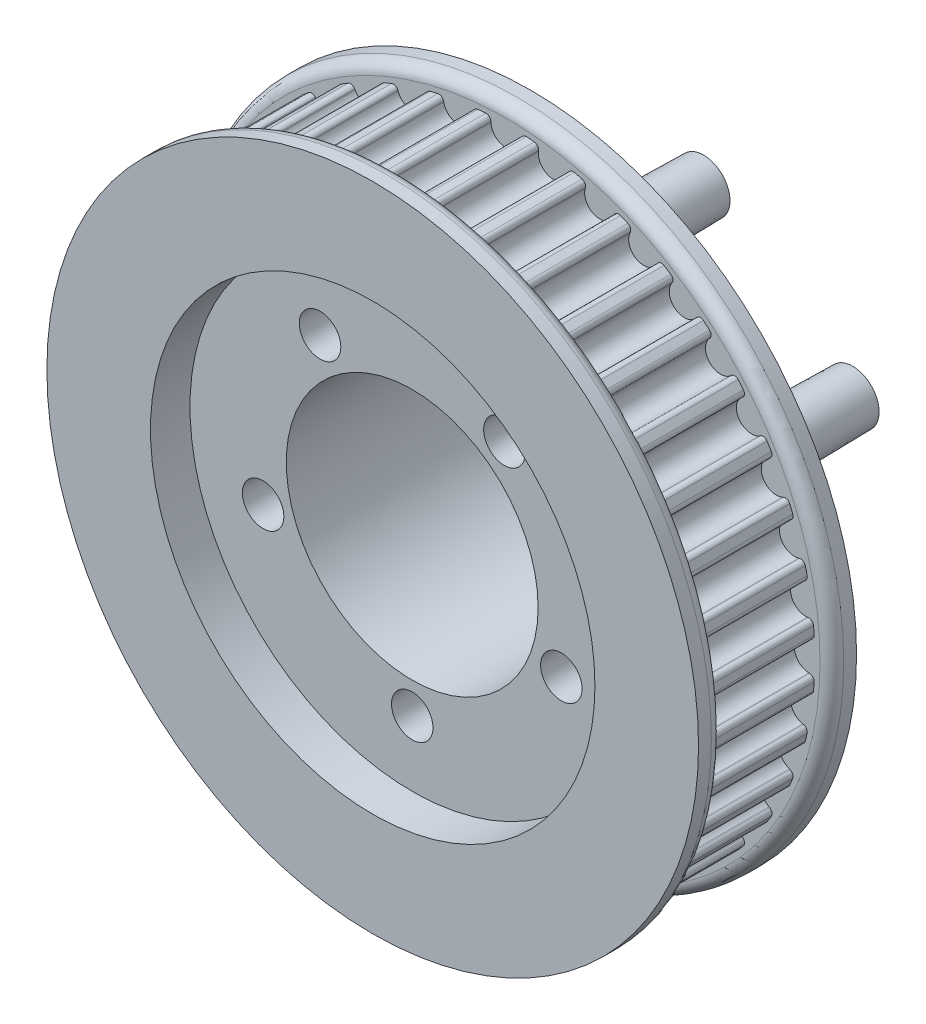
from build123d import *

# Parameters (mm, degrees)
SKETCH_3_R                       = 31.259488618
EXTRUDE_2_DEPTH                  = 11
CUT_EXTRUDE_2_DEPTH              = 46.555584261
FILLET_1_R                       = 0.48
PATTERN_CIRCULAR_1_COUNT         = 40
FILLET_1_OF_PATTERN_CIRCULAR_1_R = 0.48
SKETCH_8_R                       = 32.989488618
EXTRUDE_3_DEPTH                  = 2.5
EXTRUDE_START                    = 2.5
SKETCH_9_R                       = 32.989488618
EXTRUDE_4_DEPTH                  = 2.5
SKETCH_10_R                      = 2.675
EXTRUDE_5_DEPTH                  = 20
M5X0_8_2_D                       = 4.2
SKETCH_4_R                       = 12.75
CUT_EXTRUDE_3_DEPTH              = 55.155911257
FILLET_2_R                       = 1.2
SKETCH_16_R                      = 22.5
CUT_EXTRUDE_4_DEPTH              = 4


with BuildPart() as part:
    # 스케치3 → 보스-돌출2 (new body)
    with BuildSketch(Plane.XY):
        Circle(SKETCH_3_R)
    extrude(amount=EXTRUDE_2_DEPTH)

    # 스케치3<3> → 컷-돌출2 (cut, symmetric)
    with BuildSketch(Plane.XY):
        with BuildLine():
            Line((-1.561728679, 31.220452146), (-1.533083111, 30.647799791))
            ThreePointArc((-1.533083111, 30.647799791), (0, 29.189488618), (1.533083111, 30.647799791))
            Line((1.533083111, 30.647799791), (1.561728679, 31.220452146))
            ThreePointArc((1.561728679, 31.220452146), (0, 31.259488618), (-1.561728679, 31.220452146))
        make_face()
    cut_extrude_2 = extrude(amount=CUT_EXTRUDE_2_DEPTH, both=True, mode=Mode.SUBTRACT)

    # 필렛1
    fillet_1_edges = [part.edges().sort_by_distance(p)[0] for p in [
        (-1.561728679, 31.220452146, 5.5),
        (1.561728679, 31.220452146, 5.5),
    ]]
    fillet(fillet_1_edges, radius=FILLET_1_R)

    # 원형 패턴1: 컷-돌출2 ×40 about axis
    pattern_circular_1_axis = Axis((0, 0, 0), (0, 0, 1))
    for i in range(1, PATTERN_CIRCULAR_1_COUNT):
        add(cut_extrude_2.rotate(pattern_circular_1_axis, i * 360 / PATTERN_CIRCULAR_1_COUNT), mode=Mode.SUBTRACT)

    # 필렛1 of 원형 패턴1
    fillet_1_of_pattern_circular_1_edges = [part.edges().sort_by_distance(p)[0] for p in [
        (-6.426455937, 30.591768382, 5.5),
        (-3.341453522, 31.080384763, 5.5),
        (-11.132942522, 29.209813753, 5.5),
        (-8.162358048, 30.175015158, 5.5),
        (-15.565299114, 27.108616567, 5.5),
        (-12.78227823, 28.526636534, 5.5),
        (-19.614386384, 24.339915273, 5.5),
        (-17.087456299, 26.175837444, 5.5),
        (-23.180502364, 20.971884485, 5.5),
        (-20.971884485, 23.180502364, 5.5),
        (-26.175837444, 17.087456299, 5.5),
        (-24.339915273, 19.614386384, 5.5),
        (-28.526636534, 12.78227823, 5.5),
        (-27.108616567, 15.565299114, 5.5),
        (-30.175015158, 8.162358048, 5.5),
        (-29.209813753, 11.132942522, 5.5),
        (-31.080384763, 3.341453522, 5.5),
        (-30.591768382, 6.426455937, 5.5),
        (-31.220452146, -1.561728679, 5.5),
        (-31.220452146, 1.561728679, 5.5),
        (-30.591768382, -6.426455937, 5.5),
        (-31.080384763, -3.341453522, 5.5),
        (-29.209813753, -11.132942522, 5.5),
        (-30.175015158, -8.162358048, 5.5),
        (-27.108616567, -15.565299114, 5.5),
        (-28.526636534, -12.78227823, 5.5),
        (-24.339915273, -19.614386384, 5.5),
        (-26.175837444, -17.087456299, 5.5),
        (-20.971884485, -23.180502364, 5.5),
        (-23.180502364, -20.971884485, 5.5),
        (-17.087456299, -26.175837444, 5.5),
        (-19.614386384, -24.339915273, 5.5),
        (-12.78227823, -28.526636534, 5.5),
        (-15.565299114, -27.108616567, 5.5),
        (-8.162358048, -30.175015158, 5.5),
        (-11.132942522, -29.209813753, 5.5),
        (-3.341453522, -31.080384763, 5.5),
        (-6.426455937, -30.591768382, 5.5),
        (1.561728679, -31.220452146, 5.5),
        (-1.561728679, -31.220452146, 5.5),
        (6.426455937, -30.591768382, 5.5),
        (3.341453522, -31.080384763, 5.5),
        (11.132942522, -29.209813753, 5.5),
        (8.162358048, -30.175015158, 5.5),
        (15.565299114, -27.108616567, 5.5),
        (12.78227823, -28.526636534, 5.5),
        (19.614386384, -24.339915273, 5.5),
        (17.087456299, -26.175837444, 5.5),
        (23.180502364, -20.971884485, 5.5),
        (20.971884485, -23.180502364, 5.5),
        (26.175837444, -17.087456299, 5.5),
        (24.339915273, -19.614386384, 5.5),
        (28.526636534, -12.78227823, 5.5),
        (27.108616567, -15.565299114, 5.5),
        (30.175015158, -8.162358048, 5.5),
        (29.209813753, -11.132942522, 5.5),
        (31.080384763, -3.341453522, 5.5),
        (30.591768382, -6.426455937, 5.5),
        (31.220452146, 1.561728679, 5.5),
        (31.220452146, -1.561728679, 5.5),
        (30.591768382, 6.426455937, 5.5),
        (31.080384763, 3.341453522, 5.5),
        (29.209813753, 11.132942522, 5.5),
        (30.175015158, 8.162358048, 5.5),
        (27.108616567, 15.565299114, 5.5),
        (28.526636534, 12.78227823, 5.5),
        (24.339915273, 19.614386384, 5.5),
        (26.175837444, 17.087456299, 5.5),
        (20.971884485, 23.180502364, 5.5),
        (23.180502364, 20.971884485, 5.5),
        (17.087456299, 26.175837444, 5.5),
        (19.614386384, 24.339915273, 5.5),
        (12.78227823, 28.526636534, 5.5),
        (15.565299114, 27.108616567, 5.5),
        (8.162358048, 30.175015158, 5.5),
        (11.132942522, 29.209813753, 5.5),
        (3.341453522, 31.080384763, 5.5),
        (6.426455937, 30.591768382, 5.5),
    ]]
    fillet(fillet_1_of_pattern_circular_1_edges, radius=FILLET_1_OF_PATTERN_CIRCULAR_1_R)

    # 스케치8 → 보스-돌출3 (add)
    with BuildSketch(Plane.XY.offset(11)):
        Circle(SKETCH_8_R)
    extrude(amount=EXTRUDE_3_DEPTH)

    # 스케치9 → 보스-돌출4 (add)
    with BuildSketch(Plane(origin=(0, 0, 0), x_dir=(-1, 0, 0), z_dir=(0, 0, -1)).offset(EXTRUDE_START)):
        with Locations(Location((0, 0, 0), (0, 0, 180))):
            Circle(SKETCH_9_R)
    extrude(amount=-EXTRUDE_4_DEPTH)

    # 스케치7 → 회전2 (revolve)
    with BuildSketch(Plane.ZY, mode=Mode.PRIVATE) as revolve_2_sk:
        with BuildLine():
            ThreePointArc((-4.240068416, 29.346727485), (-5.749332253, 25.810608837), (-6.594876915, 22.06))
            Line((-6.594876915, 22.06), (-0.344876915, 22.06))
            Line((-0.344876915, 22.06), (-0.344876915, 27.097837623))
            Line((-0.344876915, 27.097837623), (-4.240068416, 29.346727485))
        make_face()
        with BuildLine():
            Line((-14, 11), (-14, 0))
            Line((-14, 0), (-0.344876915, 0))
            Line((-0.344876915, 0), (-0.344876915, 22.06))
            Line((-0.344876915, 22.06), (-6.594876915, 22.06))
            ThreePointArc((-6.594876915, 22.06), (-11.97778804, 17.655062883), (-14, 11))
        make_face()
    revolve(revolve_2_sk.sketch.rotate(Axis((0, 0, -14), (0, 0, 1)), 90), axis=Axis((0, 0, -14), (0, 0, 1)))

    # 스케치10 → 보스-돌출5 (add)
    with BuildSketch(Plane.XY):
        with Locations((0, 15.875)):
            Circle(SKETCH_10_R)
        with Locations((15.098022196, 4.905644786)):
            Circle(SKETCH_10_R)
        with Locations((9.33109088, -12.843144786)):
            Circle(SKETCH_10_R)
        with Locations((-9.33109088, -12.843144786)):
            Circle(SKETCH_10_R)
        with Locations((-15.098022196, 4.905644786)):
            Circle(SKETCH_10_R)
    extrude(amount=-EXTRUDE_5_DEPTH)

    # M5x0.8 탭을 위한 탭 드릴2 (through all)
    with Locations(Plane(origin=(0, 0, 13.5), x_dir=(-1, 0, 0), z_dir=(0, 0, 1))):
        with Locations((-15.098022196, 4.905644786), (0, 15.875), (15.098022196, 4.905644786), (9.33109088, -12.843144786), (-9.33109088, -12.843144786)):
            Hole(M5X0_8_2_D / 2)

    # 구배1: read off the stored shape, not the designer's step
    # 구배1: loft between two sections, ruled curve by curve
    draft_1_from = [
        Edge.make_three_point_arc((1.146677384, 18.291765602, -20), (-2.416765602, 17.021677384, -20), (-1.146677384, 13.458234398, -20)),
        Edge.make_three_point_arc((-1.146677384, 13.458234398, -20), (2.416765602, 14.728322616, -20), (1.146677384, 18.291765602, -20)),
    ]
    draft_1_to = [
        Edge.make_three_point_arc((1.212608049, 18.430722701, -11.188526797), (-2.555722701, 17.087608049, -11.188526797), (-1.212608049, 13.319277299, -11.188526797)),
        Edge.make_three_point_arc((-1.212608049, 13.319277299, -11.188526797), (2.555722701, 14.662391951, -11.188526797), (1.212608049, 18.430722701, -11.188526797)),
    ]
    draft_1 = Solid(Shell([*[Face.make_surface_from_curves(draft_1_from[k], draft_1_to[k]) for k in range(2)], Face(Wire(draft_1_from)), Face(Wire(draft_1_to))]))
    add(draft_1)

    # Draft 1 2: loft between two sections, ruled curve by curve
    draft_1_2_from = [
        Edge.make_three_point_arc((16.670799013, 7.069437309, -20), (12.934229673, 6.478421603, -20), (13.525245379, 2.741852263, -20)),
        Edge.make_three_point_arc((13.525245379, 2.741852263, -20), (17.261814719, 3.332867968, -20), (16.670799013, 7.069437309, -20)),
    ]
    draft_1_2_to = [
        Edge.make_three_point_arc((16.761230534, 7.19385105, -11.188394397), (12.809815932, 6.568853123, -11.188394397), (13.434813859, 2.617438522, -11.188394397)),
        Edge.make_three_point_arc((13.434813859, 2.617438522, -11.188394397), (17.38622846, 3.242436448, -11.188394397), (16.761230534, 7.19385105, -11.188394397)),
    ]
    draft_1_2 = Solid(Shell([*[Face.make_surface_from_curves(draft_1_2_from[k], draft_1_2_to[k]) for k in range(2)], Face(Wire(draft_1_2_from)), Face(Wire(draft_1_2_to))]))
    add(draft_1_2)

    # Draft 1 3: loft between two sections, ruled curve by curve
    draft_1_3_from = [
        Edge.make_three_point_arc((11.114973746, -10.849809159, -20), (7.337755254, -11.05926192, -20), (7.547208014, -14.836480412, -20)),
        Edge.make_three_point_arc((7.547208014, -14.836480412, -20), (11.324426507, -14.627027652, -20), (11.114973746, -10.849809159, -20)),
    ]
    draft_1_3_to = [
        Edge.make_three_point_arc((11.217540305, -10.735199854, -11.188663889), (7.223145949, -10.956695361, -11.188663889), (7.444641455, -14.951089717, -11.188663889)),
        Edge.make_three_point_arc((7.444641455, -14.951089717, -11.188663889), (11.439035812, -14.729594211, -11.188663889), (11.217540305, -10.735199854, -11.188663889)),
    ]
    draft_1_3 = Solid(Shell([*[Face.make_surface_from_curves(draft_1_3_from[k], draft_1_3_to[k]) for k in range(2)], Face(Wire(draft_1_3_from)), Face(Wire(draft_1_3_to))]))
    add(draft_1_3)

    # Draft 1 4: loft between two sections, ruled curve by curve
    draft_1_4_from = [
        Edge.make_three_point_arc((-7.453607328, -10.937710318, -20), (-11.236525348, -10.965661234, -20), (-11.208574432, -14.748579254, -20)),
        Edge.make_three_point_arc((-11.208574432, -14.748579254, -20), (-7.425656412, -14.720628338, -20), (-7.453607328, -10.937710318, -20)),
    ]
    draft_1_4_to = [
        Edge.make_three_point_arc((-7.345657303, -10.828153193, -11.188518686), (-11.346082473, -10.857711209, -11.188518686), (-11.316524457, -14.858136378, -11.188518686)),
        Edge.make_three_point_arc((-11.316524457, -14.858136378, -11.188518686), (-7.316099288, -14.828578363, -11.188518686), (-7.345657303, -10.828153193, -11.188518686)),
    ]
    draft_1_4 = Solid(Shell([*[Face.make_surface_from_curves(draft_1_4_from[k], draft_1_4_to[k]) for k in range(2)], Face(Wire(draft_1_4_from)), Face(Wire(draft_1_4_to))]))
    add(draft_1_4)

    # Draft 1 5: loft between two sections, ruled curve by curve
    draft_1_5_from = [
        Edge.make_three_point_arc((-13.902211904, 7.298480498, -20), (-17.490857908, 6.101455078, -20), (-16.293832488, 2.512809074, -20)),
        Edge.make_three_point_arc((-16.293832488, 2.512809074, -20), (-12.705186484, 3.709834493, -20), (-13.902211904, 7.298480498, -20)),
    ]
    draft_1_5_to = [
        Edge.make_three_point_arc((-13.833456525, 7.436061123, -11.188563546), (-17.628438533, 6.170210457, -11.188563546), (-16.362587868, 2.375228449, -11.188563546)),
        Edge.make_three_point_arc((-16.362587868, 2.375228449, -11.188563546), (-12.567605859, 3.641079114, -11.188563546), (-13.833456525, 7.436061123, -11.188563546)),
    ]
    draft_1_5 = Solid(Shell([*[Face.make_surface_from_curves(draft_1_5_from[k], draft_1_5_to[k]) for k in range(2)], Face(Wire(draft_1_5_from)), Face(Wire(draft_1_5_to))]))
    add(draft_1_5)

    # 스케치4 → 컷-돌출3 (cut, through all)
    with BuildSketch(Plane(origin=(0, 0, -14), x_dir=(-1, 0, 0), z_dir=(0, 0, -1))):
        with Locations(Location((0, 0, 0), (0, 0, 90))):
            Circle(SKETCH_4_R)
    extrude(amount=-CUT_EXTRUDE_3_DEPTH, mode=Mode.SUBTRACT)

    # 필렛2
    fillet_2_edges = [part.edges().sort_by_distance(p)[0] for p in [
        (-32.989488618, 0, 11),
        (-32.989488618, 0, 0),
    ]]
    fillet(fillet_2_edges, radius=FILLET_2_R)

    # 스케치16 → 컷-돌출4 (cut)
    with BuildSketch(Plane.XY.offset(13.5)):
        Circle(SKETCH_16_R)
    extrude(amount=-CUT_EXTRUDE_4_DEPTH, mode=Mode.SUBTRACT)


solid = part.part
